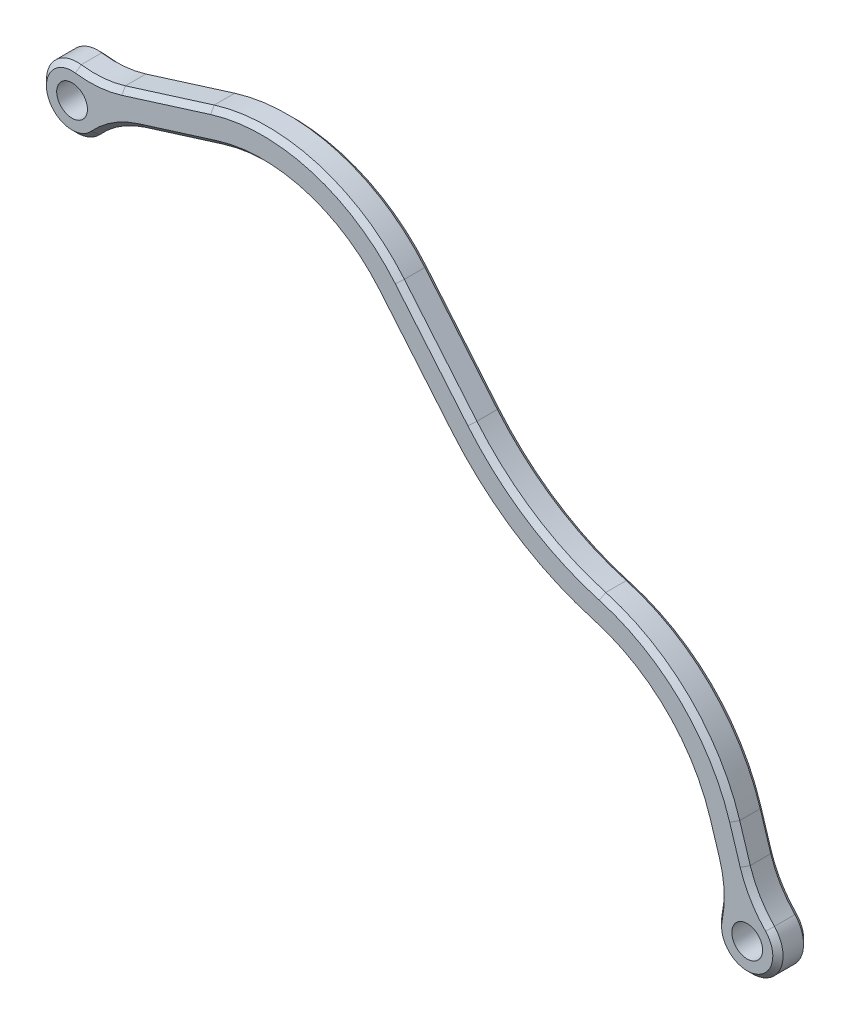
from build123d import *

# Parameters (mm, degrees)
EXTRUDE_THIN1_DEPTH = 3
SKETCH2_R           = 3
SKETCH2_R_2         = 1.5
BOSS_EXTRUDE1_DEPTH = 3
FILLET1_R           = 10
CHAMFER1_SIZE       = 0.5


with BuildPart() as part:
    # Sketch1 → Extrude-Thin1 (new body)
    with BuildSketch(Plane.XY):
        with BuildLine():
            Line((57.099977554, 74.130994908), (68.956647476, 77.838390224))
            ThreePointArc((68.956647476, 77.838390224), (77.323326626, 77.911102483), (84.321848628, 73.325549425))
            Line((84.321848628, 73.325549425), (91.394719561, 64.866720926))
            ThreePointArc((91.394719561, 64.866720926), (97.739728777, 59.242678337), (105.457489948, 55.731957687))
            ThreePointArc((105.457489948, 55.731957687), (112.329773126, 51.749112401), (116.485212172, 44.979794934))
            Line((116.485212172, 44.979794934), (118.635156901, 38.104028299))
            Line((118.635156901, 38.104028299), (121.498446505, 38.999334193))
            Line((121.498446505, 38.999334193), (119.348501776, 45.875100828))
            ThreePointArc((119.348501776, 45.875100828), (114.424086873, 53.897099814), (106.280068078, 58.616981989))
            ThreePointArc((106.280068078, 58.616981989), (99.373934451, 61.758502619), (93.696189243, 66.791100645))
            Line((93.696189243, 66.791100645), (86.623318309, 75.249929145))
            ThreePointArc((86.623318309, 75.249929145), (78.168733091, 80.789520088), (68.061341582, 80.701679828))
            Line((68.061341582, 80.701679828), (56.20467166, 76.994284512))
            Line((56.20467166, 76.994284512), (57.099977554, 74.130994908))
        make_face()
    extrude(amount=EXTRUDE_THIN1_DEPTH)

    # Sketch2 → Boss-Extrude1 (add)
    # profile 1 of 2: a face of its own
    with BuildSketch(Plane.XY):
        with Locations((54.688304819, 74.650726943)):
            Circle(SKETCH2_R)
        with Locations((54.688304819, 74.650726943)):
            Circle(SKETCH2_R_2, mode=Mode.SUBTRACT)
    # profile 2 of 2: a face of its own
    with BuildSketch(Plane.XY):
        with Locations((120.577889297, 36.531003584)):
            Circle(SKETCH2_R)
        with Locations((120.577889297, 36.531003584)):
            Circle(SKETCH2_R_2, mode=Mode.SUBTRACT)
    extrude(amount=BOSS_EXTRUDE1_DEPTH)

    # Fillet1
    fillet1_edges = [part.edges().sort_by_distance(p)[0] for p in [
        (118.462014922, 38.65775595, 1.5),
        (121.365070325, 39.425886315, 1.5),
        (57.66876055, 74.308844459, 1.5),
        (56.457676997, 77.073395326, 1.5),
    ]]
    fillet(fillet1_edges, radius=FILLET1_R)

    # Chamfer1
    chamfer1_edges = [part.edges().sort_by_distance(p)[0] for p in [
        (112.329773126, 51.749112401, 0),
        (97.739728777, 59.242678337, 0),
        (116.934244631, 43.543738296, 0),
        (87.858284095, 69.096135176, 0),
        (117.825900309, 39.634592765, 0),
        (77.323326626, 77.911102483, 0),
        (121.418565487, 33.651200892, 0),
        (65.140699156, 76.645202843, 0),
        (121.323535892, 40.463244613, 0),
        (58.928727799, 74.336925163, 0),
        (119.862832309, 44.230213557, 0),
        (51.870334324, 73.621629137, 0),
        (114.424086873, 53.897099814, 0),
        (57.260461996, 77.572312544, 0),
        (99.373934451, 61.758502619, 0),
        (63.72814628, 79.346757403, 0),
        (90.159753776, 71.020514895, 0),
        (78.168733091, 80.789520088, 0),
        (112.329773126, 51.749112401, 3),
        (97.739728777, 59.242678337, 3),
        (116.934244631, 43.543738296, 3),
        (87.858284095, 69.096135176, 3),
        (117.825900309, 39.634592765, 3),
        (77.323326626, 77.911102483, 3),
        (121.418565487, 33.651200892, 3),
        (65.140699156, 76.645202843, 3),
        (121.323535892, 40.463244613, 3),
        (58.928727799, 74.336925163, 3),
        (119.862832309, 44.230213557, 3),
        (51.870334324, 73.621629137, 3),
        (114.424086873, 53.897099814, 3),
        (57.260461996, 77.572312544, 3),
        (99.373934451, 61.758502619, 3),
        (63.72814628, 79.346757403, 3),
        (90.159753776, 71.020514895, 3),
        (78.168733091, 80.789520088, 3),
    ]]
    chamfer(chamfer1_edges, length=CHAMFER1_SIZE)


solid = part.part
